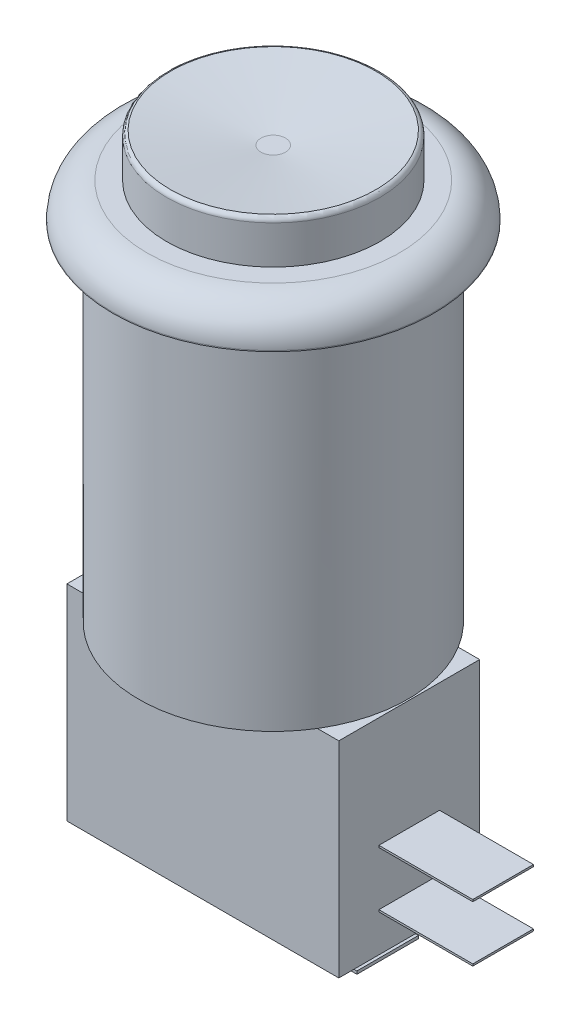
from build123d import *

# Parameters (mm, degrees)
SKETCH1_R           = 13.75
BOSS_EXTRUDE1_DEPTH = 35.5
SKETCH2_R           = 16.4
BOSS_EXTRUDE2_DEPTH = 3.6
SKETCH3_R           = 10.9
BOSS_EXTRUDE3_DEPTH = 4.4
FILLET1_R           = 3.5
SKETCH4_R           = 0.5
CUT_EXTRUDE1_DEPTH  = 1.3
CHAMFER1_SIZE       = 10
CHAMFER1_SIZE_2     = 1.405408347
FILLET2_R           = 0.5
SKETCH5_W           = 27.8
SKETCH5_H           = 14.4
BOSS_EXTRUDE4_DEPTH = 21
SKETCH6_W           = 10
SKETCH6_H           = 6.3
BOSS_EXTRUDE5_DEPTH = 2.8
SKETCH7_W           = 6.3
SKETCH7_H           = 2.5
CUT_EXTRUDE2_DEPTH  = 9.8
SKETCH8_W           = 6.2
SKETCH8_H           = 0.2
BOSS_EXTRUDE6_DEPTH = 9.6


with BuildPart() as part:
    # Sketch1 → Boss-Extrude1 (new body)
    with BuildSketch(Plane(origin=(0, 0, 0), x_dir=(1, 0, 0), z_dir=(0, 1, 0))):
        with Locations(Location((0, 0, 0), (0, 0, 270))):
            Circle(SKETCH1_R)
    extrude(amount=BOSS_EXTRUDE1_DEPTH)

    # Sketch2 → Boss-Extrude2 (add)
    with BuildSketch(Plane(origin=(0, 35.5, 0), x_dir=(1, 0, 0), z_dir=(0, 1, 0))):
        with Locations(Location((0, 0, 0), (0, 0, 270))):
            Circle(SKETCH2_R)
    extrude(amount=BOSS_EXTRUDE2_DEPTH)

    # Sketch3 → Boss-Extrude3 (add)
    with BuildSketch(Plane(origin=(0, 39.1, 0), x_dir=(1, 0, 0), z_dir=(0, 1, 0))):
        with Locations(Location((0, 0, 0), (0, 0, 270))):
            Circle(SKETCH3_R)
    extrude(amount=BOSS_EXTRUDE3_DEPTH)

    # Fillet1
    fillet1_edges = [part.edges().sort_by_distance(p)[0] for p in [
        (0, 39.1, -16.4),
    ]]
    fillet(fillet1_edges, radius=FILLET1_R)

    # Sketch4 → Cut-Extrude1 (cut)
    with BuildSketch(Plane(origin=(0, 43.5, 0), x_dir=(1, 0, 0), z_dir=(0, 1, 0))):
        with Locations(Location((0, 0, 0), (0, 0, 270))):
            Circle(SKETCH4_R)
    extrude(amount=-CUT_EXTRUDE1_DEPTH, mode=Mode.SUBTRACT)

    # Chamfer1
    # the kernel refuses this chamfer: 10, 1.405408347 mm, written as the material it takes off along each edge
    with BuildSketch(Plane(origin=(0, 43.5, 0), x_dir=(0, 0, 1), z_dir=(-1, 0, 0))) as chamfer1_piece_1_section:
        Polygon((0.5 + CHAMFER1_SIZE, 0), (0.5, -CHAMFER1_SIZE_2), (0.5, 0), align=None)
    chamfer1_piece_1 = revolve(axis=Axis((0, 43.5, 0), (0, 1, 0)), mode=Mode.PRIVATE)
    chamfer1_piece_1 = split(chamfer1_piece_1, bisect_by=Plane(origin=(0, 42.2, -6.064294667), z_dir=(0, 1, 0)), keep=Keep.TOP, mode=Mode.PRIVATE)
    add(chamfer1_piece_1, mode=Mode.SUBTRACT)

    # Fillet2
    # the kernel refuses this fillet: 0.5 mm, written as the material it takes off along each edge
    with BuildSketch(Plane(origin=(0, 43.5, 0), x_dir=(0, 0, 1), z_dir=(-1, 0, 0))) as fillet2_piece_1:
        with BuildLine():
            CenterArc((10.4, -0.489897949), FILLET2_R, 0, 78.463040967)
            Line((10.5, 0), (10.502, 0.009797959))
            ThreePointArc((10.502, 0.009797959), (10.7, 0.01), (10.9, 0.01))
            Line((10.9, 0.01), (10.91, 0))
            Line((10.91, 0), (10.91, -0.489897949))
            Line((10.91, -0.489897949), (10.9, -0.489897949))
        make_face()
    revolve(axis=Axis((0, 43.5, 0), (0, 1, 0)), mode=Mode.SUBTRACT)

    # Sketch5 → Boss-Extrude4 (add)
    with BuildSketch(Plane.XZ):
        Rectangle(SKETCH5_W, SKETCH5_H)
    extrude(amount=BOSS_EXTRUDE4_DEPTH)

    # Sketch6 → Boss-Extrude5 (add)
    with BuildSketch(Plane.XZ.offset(21)):
        with Locations((6.7, 0)):
            Rectangle(SKETCH6_W, SKETCH6_H)
    extrude(amount=BOSS_EXTRUDE5_DEPTH)

    # Sketch7 → Cut-Extrude2 (cut)
    with BuildSketch(Plane(origin=(11.7, 0, 0), x_dir=(0, 0, -1), z_dir=(1, 0, 0))):
        with Locations((0, -22.25)):
            Rectangle(SKETCH7_W, SKETCH7_H)
    extrude(amount=-CUT_EXTRUDE2_DEPTH, mode=Mode.SUBTRACT)

    # Sketch8 → Boss-Extrude6 (add)
    with BuildSketch(Plane(origin=(13.9, 0, 0), x_dir=(0, 0, -1), z_dir=(1, 0, 0))):
        with Locations((0, -17.1)):
            Rectangle(SKETCH8_W, SKETCH8_H)
        with Locations((0, -11.4)):
            Rectangle(SKETCH8_W, SKETCH8_H)
    extrude(amount=BOSS_EXTRUDE6_DEPTH)


solid = part.part
